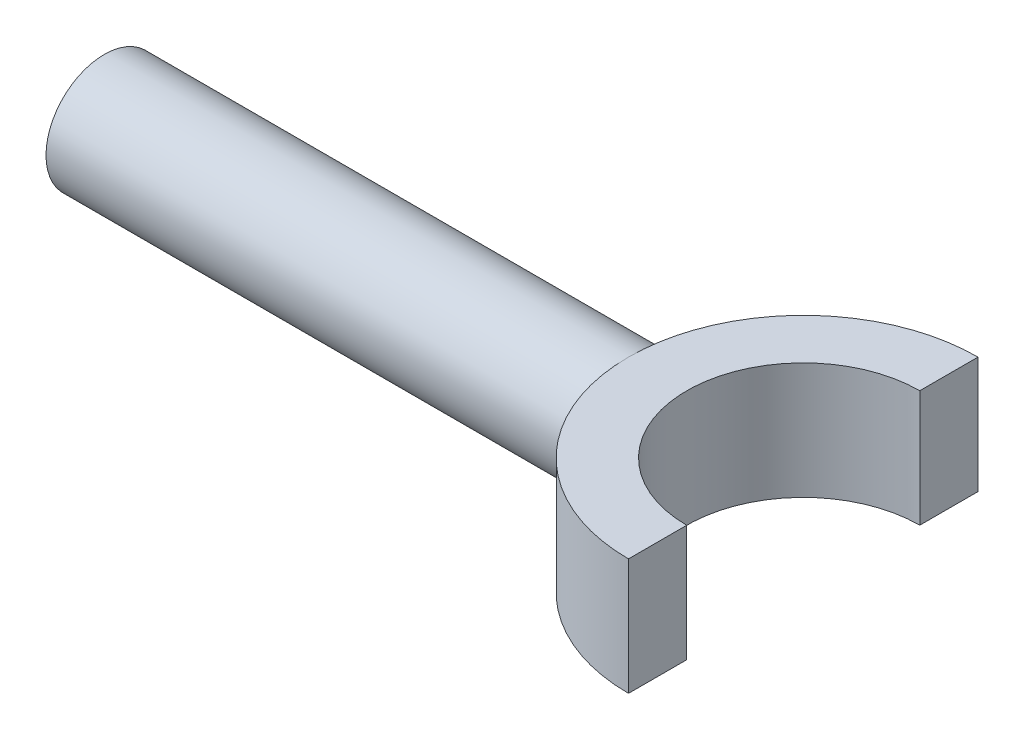
from build123d import *

# Parameters (mm, degrees)
BOSS_EXTRUDE1_DEPTH      = 6.35
BOSS_EXTRUDE2_REACH      = 80.801
BOSS_EXTRUDE2_END_RADIUS = 19.05
SKETCH2_R                = 6.35


with BuildPart() as part:
    # Sketch1 → Boss-Extrude1 (new, symmetric)
    with BuildSketch(Plane(origin=(0, 0, 0), x_dir=(1, 0, 0), z_dir=(0, 1, 0))):
        with BuildLine():
            Line((0, 19.05), (0, 12.7))
            ThreePointArc((0, 12.7), (-12.7, 0), (0, -12.7))
            Line((0, -12.7), (0, -19.05))
            ThreePointArc((0, -19.05), (-19.05, 0), (0, 19.05))
        make_face()
    extrude(amount=BOSS_EXTRUDE1_DEPTH, both=True)

    # Boss-Extrude2: up to this cylinder (the profile starts outside it)
    boss_extrude2_end = Plane(origin=(0, 0, 0), z_dir=(0, -1, 0)) * Cylinder(BOSS_EXTRUDE2_END_RADIUS, 200.702, mode=Mode.PRIVATE)
    # Sketch2 → Boss-Extrude2 (add, up to the surface)
    with BuildSketch(Plane.ZY.offset(76.2), mode=Mode.PRIVATE) as boss_extrude2_sk1:
        Circle(SKETCH2_R)
    boss_extrude2_tool1 = extrude(boss_extrude2_sk1.sketch, amount=-BOSS_EXTRUDE2_REACH, mode=Mode.PRIVATE) - boss_extrude2_end
    add(boss_extrude2_tool1.solids().sort_by_distance((-76.2, 0, 0))[0])


solid = part.part
